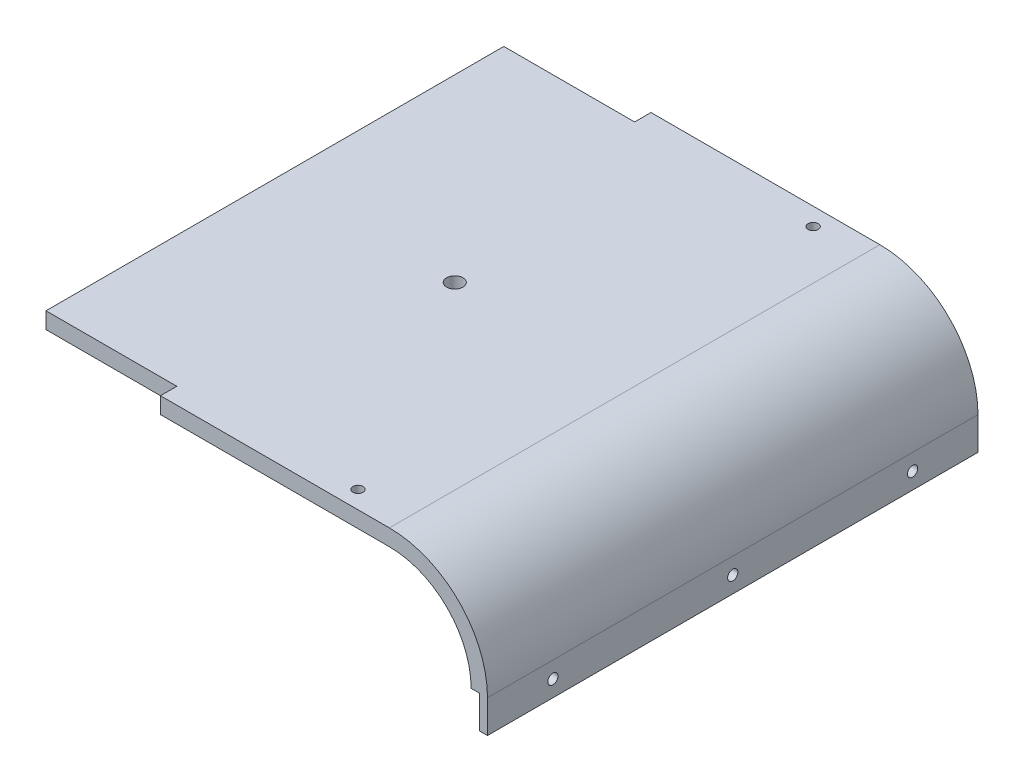
from build123d import *

# Parameters (mm, degrees)
BOSS_EXTRUDE1_DEPTH      = 190.5
BOSS_EXTRUDE1_DEPTH_BACK = 190.5
SKETCH2_W                = 6.35
SKETCH2_H                = 381
BOSS_EXTRUDE2_DEPTH      = 25.4
SKETCH3_R                = 3.96875
CUT_EXTRUDE1_DEPTH       = 25.4
SKETCH4_R                = 6.35
CUT_EXTRUDE2_DEPTH       = 17.78
SKETCH5_R                = 3.937
CUT_EXTRUDE3_DEPTH       = 306.328708116


with BuildPart() as part:
    # Sketch1 → Boss-Extrude1 (new, two sides: drawn at the far end of the back side and taken through both)
    with BuildSketch(Plane.XY.offset(-BOSS_EXTRUDE1_DEPTH_BACK)):
        with BuildLine():
            Line((-139.7, 0), (139.7, 0))
            ThreePointArc((139.7, 0), (193.581536726, -22.318463274), (215.9, -76.2))
            Line((215.9, -76.2), (203.2, -76.2))
            ThreePointArc((203.2, -76.2), (184.601280605, -31.298719395), (139.7, -12.7))
            Line((139.7, -12.7), (-139.7, -12.7))
            Line((-139.7, -12.7), (-139.7, 0))
        make_face()
    extrude(amount=BOSS_EXTRUDE1_DEPTH + BOSS_EXTRUDE1_DEPTH_BACK)

    # Sketch2 → Boss-Extrude2 (add)
    with BuildSketch(Plane.XZ.offset(76.2)):
        with Locations((212.725, 0)):
            Rectangle(SKETCH2_W, SKETCH2_H)
    extrude(amount=BOSS_EXTRUDE2_DEPTH)

    # Sketch3 → Cut-Extrude1 (cut)
    with BuildSketch(Plane(origin=(215.9, 0, 0), x_dir=(0, 0, -1), z_dir=(1, 0, 0))):
        with Locations((-139.7, -88.9)):
            Circle(SKETCH3_R)
        with Locations((0, -88.9)):
            Circle(SKETCH3_R)
        with Locations((139.7, -88.9)):
            Circle(SKETCH3_R)
    extrude(amount=-CUT_EXTRUDE1_DEPTH, mode=Mode.SUBTRACT)

    # Sketch4 → Cut-Extrude2 (cut)
    with BuildSketch(Plane(origin=(0, 0, 0), x_dir=(1, 0, 0), z_dir=(0, 1, 0))):
        Circle(SKETCH4_R)
    extrude(amount=-CUT_EXTRUDE2_DEPTH, mode=Mode.SUBTRACT)

    # Sketch5 → Cut-Extrude3 (cut, through all)
    with BuildSketch(Plane(origin=(0, 0, 0), x_dir=(1, 0, 0), z_dir=(0, 1, 0))):
        with Locations((101.6, -176.784)):
            Circle(SKETCH5_R)
        with Locations((101.6, 176.784)):
            Circle(SKETCH5_R)
        Polygon((-101.6, -177.8), (-139.7, -177.8), (-139.7, -190.5), (-38.1, -190.5), (-38.1, -177.8), align=None)
        Polygon((-38.1, 190.5), (-38.1, 177.8), (-101.6, 177.8), (-139.7, 177.8), (-139.7, 190.5), align=None)
    extrude(amount=-CUT_EXTRUDE3_DEPTH, mode=Mode.SUBTRACT)


solid = part.part
